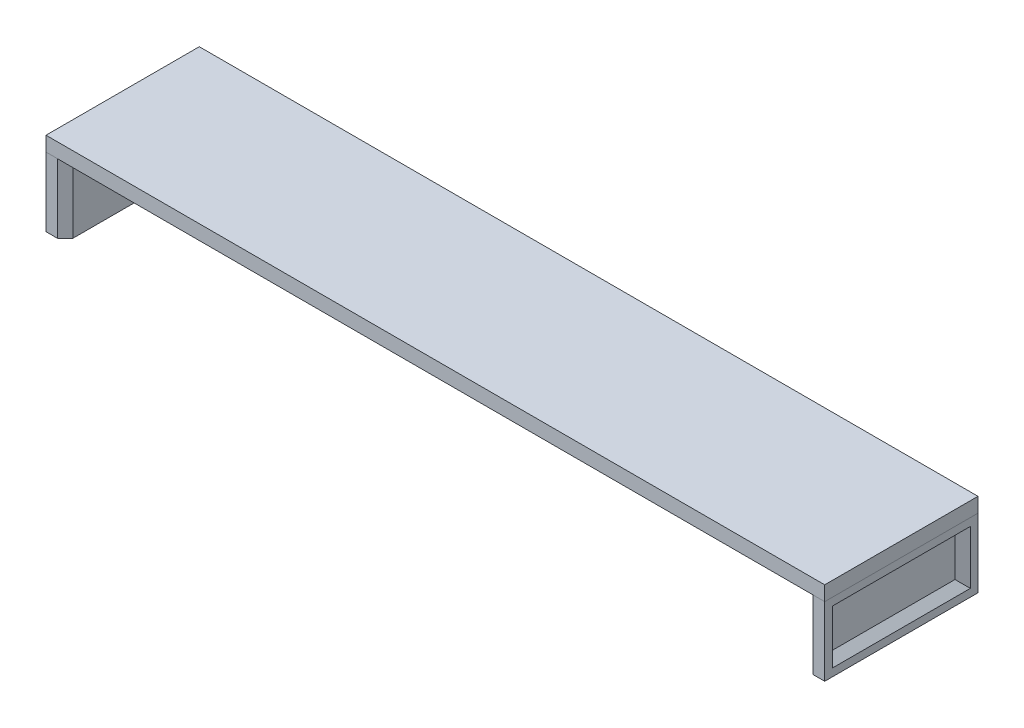
from build123d import *

# Parameters (mm, degrees)
SKETCH1_W             = 1016
SKETCH1_H             = 200
BOSS_EXTRUDE1_DEPTH   = 19.05
SKETCH2_W             = 25
SKETCH2_H             = 200
BOSS_EXTRUDE3_DEPTH   = 90
SKETCH8_W             = 180
SKETCH8_H             = 70
CUT_EXTRUDE5_DEPTH    = 10
CHAMFER2_SIZE         = 10
SKETCH10_R            = 3
BOSS_EXTRUDE6_DEPTH   = 10
BOSS_EXTRUDE6_2_DEPTH = 10
CHAMFER4_SIZE         = 2.5
CHAMFER5_SIZE         = 10


with BuildPart() as part:
    # Sketch1 → Boss-Extrude1 (new body)
    with BuildSketch(Plane(origin=(0, 0, 0), x_dir=(1, 0, 0), z_dir=(0, 1, 0))):
        with Locations((508, 100)):
            Rectangle(SKETCH1_W, SKETCH1_H)
    extrude(amount=BOSS_EXTRUDE1_DEPTH)


with BuildPart() as body_2:
    # Sketch2 → Boss-Extrude3 (new body)
    with BuildSketch(Plane.XZ):
        with Locations((12.5, -100)):
            Rectangle(SKETCH2_W, SKETCH2_H)
    extrude(amount=BOSS_EXTRUDE3_DEPTH)

    # Sketch8 → Cut-Extrude5 (cut)
    with BuildSketch(Plane.ZY):
        with Locations((-100, -45)):
            Rectangle(SKETCH8_W, SKETCH8_H)
    extrude(amount=-CUT_EXTRUDE5_DEPTH, mode=Mode.SUBTRACT)

    # Chamfer2
    chamfer2_edges = [body_2.edges().sort_by_distance(p)[0] for p in [
        (10, -80, -100),
        (10, -45, -190),
        (10, -10, -100),
        (10, -45, -10),
    ]]
    chamfer(chamfer2_edges, length=CHAMFER2_SIZE - 0.0001)  # a hair under: the kernel refuses the full size


with BuildPart() as body_3:
    # Sketch10 → Boss-Extrude6 (new body)
    with BuildSketch(Plane.XZ):
        with BuildLine():
            Line((25, -175), (25, -187.853138356))
            ThreePointArc((25, -187.853138356), (27.641328746, -183.623268319), (32.5, -182.5))
            ThreePointArc((32.5, -182.5), (40, -175), (32.5, -167.5))
            ThreePointArc((32.5, -167.5), (27.641328746, -166.376731681), (25, -162.146861644))
            Line((25, -162.146861644), (25, -175))
        make_face()
        with Locations(Location((32.5, -175, 0), (0, 0, 270))):
            Circle(SKETCH10_R, mode=Mode.SUBTRACT)
    extrude(amount=BOSS_EXTRUDE6_DEPTH)


with BuildPart() as body_4:
    # Sketch10 → Boss-Extrude6 2 (new body)
    with BuildSketch(Plane.XZ):
        with BuildLine():
            Line((25, -12.146861644), (25, -25))
            Line((25, -25), (25, -37.853138356))
            ThreePointArc((25, -37.853138356), (27.641328746, -33.623268319), (32.5, -32.5))
            ThreePointArc((32.5, -32.5), (40, -25), (32.5, -17.5))
            ThreePointArc((32.5, -17.5), (27.641328746, -16.376731681), (25, -12.146861644))
        make_face()
        with Locations(Location((32.5, -25, 0), (0, 0, 270))):
            Circle(SKETCH10_R, mode=Mode.SUBTRACT)
    extrude(amount=BOSS_EXTRUDE6_2_DEPTH)


with BuildPart() as body_2_1:
    add(body_2.part)

    # Combine2: union body 4, body 3
    add(body_4.part)
    add(body_3.part)

    # Chamfer4
    chamfer4_edges = [body_2_1.edges().sort_by_distance(p)[0] for p in [
        (32.5, -10, -22),
        (32.5, -10, -172),
    ]]
    chamfer(chamfer4_edges, length=CHAMFER4_SIZE)

    # Chamfer5
    chamfer5_edges = [body_2_1.edges().sort_by_distance(p)[0] for p in [
        (25, -45, 0),
        (25, -45, -200),
    ]]
    chamfer(chamfer5_edges, length=CHAMFER5_SIZE)


with BuildPart() as body_3_2:
    # Mirror1: mirrored copy
    add(body_2_1.part.mirror(Plane.ZY.offset(-508)))


solid = Compound([part.part, body_2_1.part, body_3_2.part])
